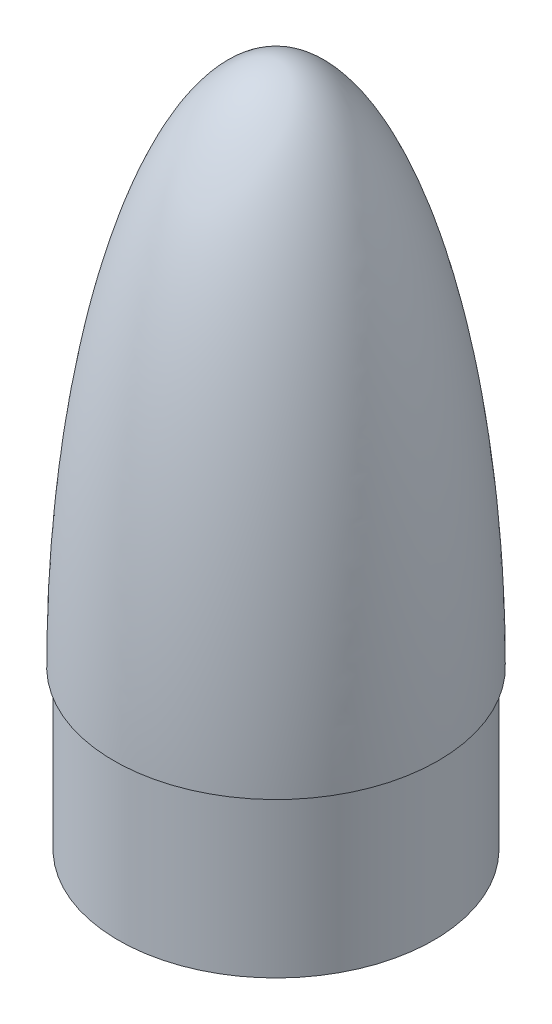
from build123d import *

# Parameters (mm, degrees)
SKETCH2_R           = 76.2
BOSS_EXTRUDE1_DEPTH = 76.2
SKETCH4_R           = 17.78
CUT_EXTRUDE1_DEPTH  = 96.52
CUT_EXTRUDE2_START  = 106.68
SKETCH5_R           = 8.255
CUT_EXTRUDE2_DEPTH  = 119.38
CUT_EXTRUDE3_START  = -25.4
SKETCH19_R          = 15.24
CUT_EXTRUDE3_DEPTH  = 101.6
SKETCH21_R          = 2.6035
CUT_EXTRUDE4_DEPTH  = 9.525
SKETCH22_R          = 2.6035
CUT_EXTRUDE5_DEPTH  = 9.525


with BuildPart() as part:
    # Sketch1 → Revolve1 (revolve)
    with BuildSketch(Plane.XY):
        with BuildLine():
            Line((78.359, 0), (0, 0))
            Line((0, 0), (0, 254))
            add(Edge.make_bspline(
                [(78.359, 0), (78.359, 0.547287489), (78.357845602, 1.649563618), (78.352650776, 3.586349875), (78.338796346, 5.988934596), (78.318010672, 8.352211569), (78.29028895, 10.745600888), (78.246958697, 13.731411826), (78.181061307, 17.311703382), (78.08386626, 21.490442467), (77.944822085, 26.264117007), (77.777683186, 31.037557631), (77.58229134, 35.809557456), (77.358460439, 40.580511863), (77.042853487, 46.542286246), (76.679080298, 52.501436144), (76.266448568, 58.457359127), (75.804102806, 64.409607399), (75.404015228, 69.168949637), (74.865626928, 75.114798701), (74.157385744, 82.243973993), (73.238266918, 90.551730955), (72.055740597, 100.030771811), (70.735528943, 109.491671534), (69.270929118, 118.931305028), (67.249996919, 130.699881306), (64.501732948, 144.763840427), (61.308555538, 158.735984092), (57.591049496, 172.577213574), (53.383025938, 186.275905479), (49.238746312, 198.044837449), (44.48323743, 209.587335711), (38.942884235, 220.71924179), (34.256173135, 228.693595393), (29.818710248, 235.095423042), (25.624249732, 240.182852143), (21.978892835, 243.926180276), (18.570150197, 246.859542723), (15.474349081, 249.076247661), (12.563405711, 250.785701438), (9.772327363, 252.083533871), (7.063069709, 253.028642362), (4.275373805, 253.686778481), (2.188006886, 253.939891173), (0.767171586, 253.999916555), (0, 254)],
                knots=[0.083290168, 0.083290168, 0.083290168, 0.083290168, 0.083290168, 0.091119674, 0.09894918, 0.106778686, 0.114608192, 0.122437698, 0.130267203, 0.145926215, 0.161585227, 0.177244239, 0.192903251, 0.208562263, 0.224221275, 0.239880287, 0.27119831, 0.286857322, 0.302516334, 0.318175346, 0.333834359, 0.365152383, 0.396470407, 0.42778843, 0.459106453, 0.490424474, 0.521742495, 0.584378539, 0.647014581, 0.678332609, 0.709650637, 0.772286631, 0.810589211, 0.841907031, 0.872607503, 0.893486158, 0.91262845, 0.928287274, 0.941044948, 0.952387223, 0.962498308, 0.97249612, 0.981348672, 0.989949856, 1, 1, 1, 1, 1], degree=4))
        make_face()
    revolve(axis=Axis((0, 254, 0), (0, -1, 0)))

    # Sketch2 → Boss-Extrude1 (add)
    with BuildSketch(Plane.XZ):
        Circle(SKETCH2_R)
    extrude(amount=BOSS_EXTRUDE1_DEPTH)

    # Sketch4 → Cut-Extrude1 (cut)
    with BuildSketch(Plane(origin=(0, 0, 0), x_dir=(1, 0, 0), z_dir=(0, 1, 0))):
        with Locations((48.26, 0)):
            Circle(SKETCH4_R)
        with Locations((0, -48.26)):
            Circle(SKETCH4_R)
        with Locations((-48.26, 0)):
            Circle(SKETCH4_R)
        with Locations((0, 48.26)):
            Circle(SKETCH4_R)
    extrude(amount=CUT_EXTRUDE1_DEPTH, mode=Mode.SUBTRACT)

    # Sketch5 → Cut-Extrude2 (cut)
    with BuildSketch(Plane(origin=(0, 0, 0), x_dir=(1, 0, 0), z_dir=(0, 1, 0)).offset(CUT_EXTRUDE2_START)):
        with Locations((20.32, 0)):
            Circle(SKETCH5_R)
        with Locations((10.16, -17.597636205)):
            Circle(SKETCH5_R)
        with Locations((-10.16, -17.597636205)):
            Circle(SKETCH5_R)
        with Locations((-20.32, 0)):
            Circle(SKETCH5_R)
        with Locations((-10.16, 17.597636205)):
            Circle(SKETCH5_R)
        with Locations((10.16, 17.597636205)):
            Circle(SKETCH5_R)
    extrude(amount=CUT_EXTRUDE2_DEPTH, mode=Mode.SUBTRACT)

    # Sketch19 → Cut-Extrude3 (cut)
    with BuildSketch(Plane(origin=(0, 0, 0), x_dir=(1, 0, 0), z_dir=(0, 1, 0)).offset(CUT_EXTRUDE3_START)):
        Circle(SKETCH19_R)
    extrude(amount=CUT_EXTRUDE3_DEPTH, mode=Mode.SUBTRACT)

    # Sketch21 → Cut-Extrude4 (cut)
    with BuildSketch(Plane.XZ.offset(76.2)):
        with Locations((-37.81298, 0)):
            Circle(SKETCH21_R)
        with Locations((0, 37.81298)):
            Circle(SKETCH21_R)
        with Locations((37.81298, 0)):
            Circle(SKETCH21_R)
        with Locations((0, -37.81298)):
            Circle(SKETCH21_R)
    extrude(amount=-CUT_EXTRUDE4_DEPTH, mode=Mode.SUBTRACT)

    # Sketch22 → Cut-Extrude5 (cut)
    with BuildSketch(Plane.XZ.offset(76.2)):
        with Locations((-35.921024484, -35.921024484)):
            Circle(SKETCH22_R)
        with Locations((-35.921024484, 35.921024484)):
            Circle(SKETCH22_R)
        with Locations((35.921024484, 35.921024484)):
            Circle(SKETCH22_R)
        with Locations((35.921024484, -35.921024484)):
            Circle(SKETCH22_R)
    extrude(amount=-CUT_EXTRUDE5_DEPTH, mode=Mode.SUBTRACT)


solid = part.part
